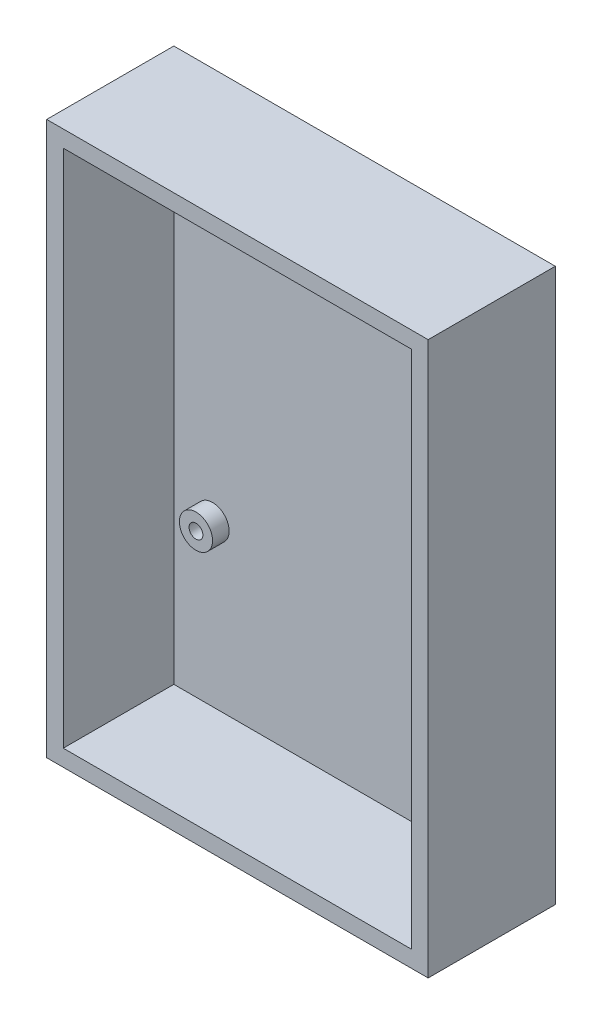
from build123d import *

# Parameters (mm, degrees)
IZIM1_W                     = 69
IZIM1_H                     = 100
Y_KSEKLIK_EKSTR_ZYON1_DEPTH = 3
IZIM2_R                     = 3
IZIM2_R_2                   = 1.25
Y_KSEKLIK_EKSTR_ZYON2_DEPTH = 3
IZIM3_W                     = 69
IZIM3_H                     = 100
IZIM3_W_2                   = 63
IZIM3_H_2                   = 94
Y_KSEKLIK_EKSTR_ZYON3_DEPTH = 20


with BuildPart() as part:
    # Çizim1 → Yükseklik-Ekstrüzyon1 (new body)
    with BuildSketch(Plane.XY):
        Rectangle(IZIM1_W, IZIM1_H)
    extrude(amount=Y_KSEKLIK_EKSTR_ZYON1_DEPTH)

    # Çizim2 → Yükseklik-Ekstrüzyon2 (add)
    # profile 1 of 4: a face of its own
    with BuildSketch(Plane.XY.offset(3)):
        with Locations((-24.5, 40)):
            Circle(IZIM2_R)
        with Locations((-24.5, 40)):
            Circle(IZIM2_R_2, mode=Mode.SUBTRACT)
    # profile 2 of 4: a face of its own
    with BuildSketch(Plane.XY.offset(3)):
        with Locations((24.5, 40)):
            Circle(IZIM2_R)
        with Locations((24.5, 40)):
            Circle(IZIM2_R_2, mode=Mode.SUBTRACT)
    # profile 3 of 4: a face of its own
    with BuildSketch(Plane.XY.offset(3)):
        with Locations((24.5, -18)):
            Circle(IZIM2_R)
        with Locations((24.5, -18)):
            Circle(IZIM2_R_2, mode=Mode.SUBTRACT)
    # profile 4 of 4: a face of its own
    with BuildSketch(Plane.XY.offset(3)):
        with Locations((-24.5, -18)):
            Circle(IZIM2_R)
        with Locations((-24.5, -18)):
            Circle(IZIM2_R_2, mode=Mode.SUBTRACT)
    extrude(amount=Y_KSEKLIK_EKSTR_ZYON2_DEPTH)

    # Çizim3 → Yükseklik-Ekstrüzyon3 (add)
    with BuildSketch(Plane.XY.offset(3)):
        Rectangle(IZIM3_W, IZIM3_H)
        Rectangle(IZIM3_W_2, IZIM3_H_2, mode=Mode.SUBTRACT)
    extrude(amount=Y_KSEKLIK_EKSTR_ZYON3_DEPTH)


solid = part.part
